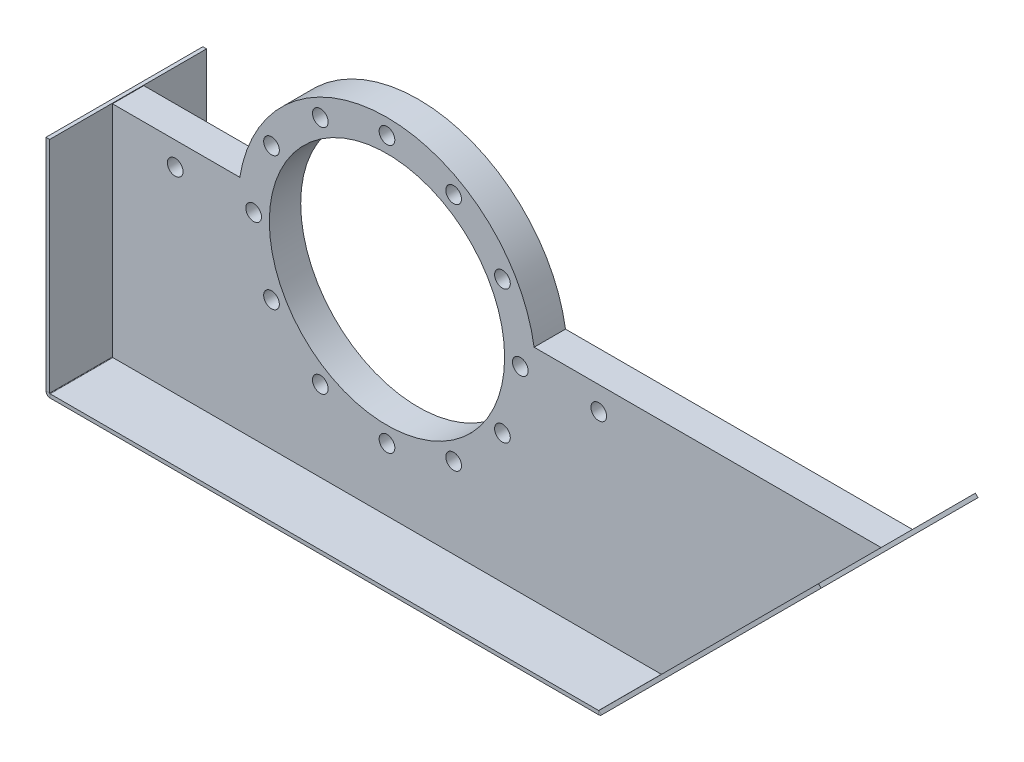
from build123d import *

# Parameters (mm, degrees)
SKETCH1_R                    = 190.5
SKETCH1_R_2                  = 12.7
BASE_FLANGE1_DEPTH           = 50.8
SKETCH26_W                   = 889
SKETCH26_H                   = 254
BASE_FLANGE2_DEPTH           = 6
EDGE_FLANGE1_STRIP_CUT_DEPTH = 254
EDGE_FLANGE1_DEPTH           = 254
EDGE_FLANGE2_STRIP_W         = 25.4732
EDGE_FLANGE2_STRIP_H         = 6
EDGE_FLANGE2_STRIP_CUT_DEPTH = 254
EDGE_FLANGE2_DEPTH           = 254


# Sheet-metal steps are written as plain solids
with BuildPart() as part:
    # Sketch1 → Base-Flange1 (new body)
    with BuildSketch(Plane.XY):
        with BuildLine():
            Line((-342.9, 38.1), (-238.273120599, 38.1))
            ThreePointArc((-238.273120599, 38.1), (0, 241.3), (238.273120599, 38.1))
            Line((238.273120599, 38.1), (342.9, 38.1))
            Line((342.9, 38.1), (800.1, 38.1))
            Line((800.1, 38.1), (444.5, -317.5))
            Line((444.5, -317.5), (-444.5, -317.5))
            Line((-444.5, -317.5), (-444.5, 38.1))
            Line((-444.5, 38.1), (-342.9, 38.1))
        make_face()
        Circle(SKETCH1_R, mode=Mode.SUBTRACT)
        with Locations((0, 215.9)):
            Circle(SKETCH1_R_2, mode=Mode.SUBTRACT)
        with Locations((107.95, 186.974884677)):
            Circle(SKETCH1_R_2, mode=Mode.SUBTRACT)
        with Locations((186.974884677, 107.95)):
            Circle(SKETCH1_R_2, mode=Mode.SUBTRACT)
        with Locations((215.9, 0)):
            Circle(SKETCH1_R_2, mode=Mode.SUBTRACT)
        with Locations((186.974884677, -107.95)):
            Circle(SKETCH1_R_2, mode=Mode.SUBTRACT)
        with Locations((107.95, -186.974884677)):
            Circle(SKETCH1_R_2, mode=Mode.SUBTRACT)
        with Locations((0, -215.9)):
            Circle(SKETCH1_R_2, mode=Mode.SUBTRACT)
        with Locations((-107.95, -186.974884677)):
            Circle(SKETCH1_R_2, mode=Mode.SUBTRACT)
        with Locations((-186.974884677, -107.95)):
            Circle(SKETCH1_R_2, mode=Mode.SUBTRACT)
        with Locations((-215.9, 0)):
            Circle(SKETCH1_R_2, mode=Mode.SUBTRACT)
        with Locations((-186.974884677, 107.95)):
            Circle(SKETCH1_R_2, mode=Mode.SUBTRACT)
        with Locations((-107.95, 186.974884677)):
            Circle(SKETCH1_R_2, mode=Mode.SUBTRACT)
        with Locations((-342.9, 0)):
            Circle(SKETCH1_R_2, mode=Mode.SUBTRACT)
        with Locations(Location((342.9, 0, 0), (0, 0, 180))):
            Circle(SKETCH1_R_2, mode=Mode.SUBTRACT)
    extrude(amount=-BASE_FLANGE1_DEPTH)


with BuildPart() as body_2:
    # Sketch26 → Base-Flange2 (new body)
    with BuildSketch(Plane.XZ.offset(317.5)):
        with Locations((0, -25.4)):
            Rectangle(SKETCH26_W, SKETCH26_H)
    extrude(amount=BASE_FLANGE2_DEPTH)

    # Edge-Flange1 strip (across the edge) → Edge-Flange1 strip cut (cut)
    with BuildSketch(Plane(origin=(444.5, -317.5, 101.6), x_dir=(-0.7071067811865438, 0.7071067811865512, 0), z_dir=(0, 0, -1))):
        Polygon((-22.039168001, 13.553886626), (-4.026895542, -4.458385832), (0.215745145, -0.215745145), (-17.796527314, 17.796527314), align=None)
    extrude(amount=EDGE_FLANGE1_STRIP_CUT_DEPTH, mode=Mode.SUBTRACT)

    # Edge-Flange1 section (across the edge) → Edge-Flange1 (add)
    with BuildSketch(Plane(origin=(444.5, -317.5, 101.6), x_dir=(-0.7071067811865438, 0.7071067811865512, 0), z_dir=(0, 0, -1))):
        with BuildLine():
            Line((-6, 0.30510971), (-6, 503.228718626))
            Line((-6, 503.228718626), (0, 503.228718626))
            Line((0, 503.228718626), (0, 0.30510971))
            ThreePointArc((0, 0.30510971), (0.056070336, 0.023225094), (0.215745145, -0.215745145))
            Line((0.215745145, -0.215745145), (-4.026895542, -4.458385832))
            ThreePointArc((-4.026895542, -4.458385832), (-5.487206859, -2.2728755), (-6, 0.30510971))
        make_face()
    extrude(amount=EDGE_FLANGE1_DEPTH)

    # Edge-Flange2 strip (across the edge) → Edge-Flange2 strip cut (cut)
    with BuildSketch(Plane(origin=(-444.5, -317.5, -152.4), x_dir=(1, 0, 0), z_dir=(0, 0, 1))):
        with Locations((-12, -3)):
            Rectangle(EDGE_FLANGE2_STRIP_W, EDGE_FLANGE2_STRIP_H)
    extrude(amount=EDGE_FLANGE2_STRIP_CUT_DEPTH, mode=Mode.SUBTRACT)

    # Edge-Flange2 section (across the edge) → Edge-Flange2 (add)
    with BuildSketch(Plane(origin=(-444.5, -317.5, -152.4), x_dir=(1, 0, 0), z_dir=(0, 0, 1))):
        with BuildLine():
            Line((-6, 0.7366), (-6, 356.4326))
            Line((-6, 356.4326), (0, 356.4326))
            Line((0, 356.4326), (0, 0.7366))
            ThreePointArc((0, 0.7366), (0.215745145, 0.215745145), (0.7366, 0))
            Line((0.7366, 0), (0.7366, -6))
            ThreePointArc((0.7366, -6), (-4.026895542, -4.026895542), (-6, 0.7366))
        make_face()
    extrude(amount=EDGE_FLANGE2_DEPTH)


solid = Compound([part.part, body_2.part])
